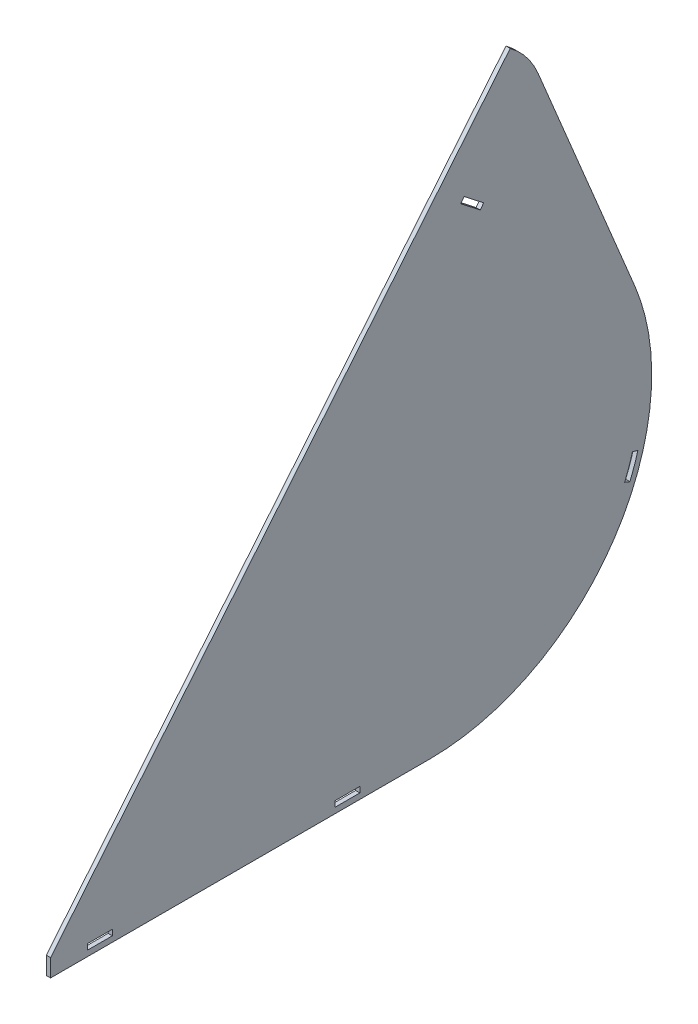
from build123d import *

# Parameters (mm, degrees)
BASE_FLANGE1_DEPTH = 6
SKETCH3_W          = 35
SKETCH3_H          = 8
CUT_EXTRUDE2_DEPTH = 6


# Sheet-metal steps are written as plain solids
with BuildPart() as part:
    # Sketch1 → Base-Flange1 (new body)
    with BuildSketch(Plane(origin=(0, 0, 0), x_dir=(0, 0, -1), z_dir=(1, 0, 0))):
        with BuildLine():
            Line((691.263386145, 750.024971585), (828.145509118, 420.991908823))
            ThreePointArc((828.145509118, 420.991908823), (799.356039458, 125.196469257), (537.308857372, -15))
            Line((537.308857372, -15), (0, -15))
            Line((0, -15), (0, 10))
            Line((0, 10), (651.687076161, 800.513923243))
            ThreePointArc((651.687076161, 800.513923243), (674.911649445, 777.963121002), (691.263386145, 750.024971585))
        make_face()
    extrude(amount=-BASE_FLANGE1_DEPTH)

    # Sketch3 → Cut-Extrude2 (cut)
    with BuildSketch(Plane(origin=(0, 0, 0), x_dir=(0, 0, -1), z_dir=(1, 0, 0))):
        with BuildLine():
            Line((832.717916058, 216.438716825), (825.035135409, 218.669161062))
            ThreePointArc((825.035135409, 218.669161062), (819.970515176, 202.5140849), (813.999628283, 186.671566993))
            Line((813.999628283, 186.671566993), (821.42397234, 183.691782549))
            ThreePointArc((821.42397234, 183.691782549), (827.533179903, 199.905831283), (832.717916058, 216.438716825))
        make_face()
        with Locations((70.170932866, -3)):
            Rectangle(SKETCH3_W, SKETCH3_H)
        with Locations((421.025597194, -3)):
            Rectangle(SKETCH3_W, SKETCH3_H)
        Polygon((581.55788083, 644.957729578), (609.163726943, 623.44221749), (614.081558277, 629.752125173), (586.475712165, 651.267637261), align=None)
    extrude(amount=-CUT_EXTRUDE2_DEPTH, mode=Mode.SUBTRACT)


solid = part.part
